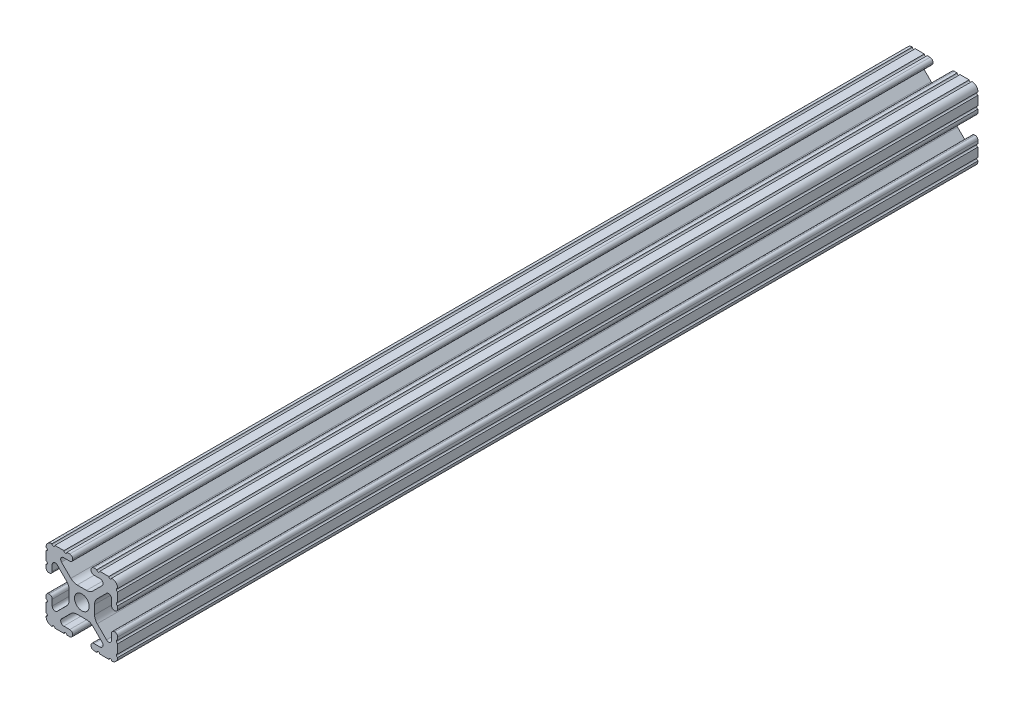
from build123d import *

# Parameters (mm, degrees)
SKETCH1_R           = 2.6035
BOSS_EXTRUDE1_DEPTH = 304.8
SKETCH2_R           = 27.881464852
CUT_EXTRUDE1_DEPTH  = 304.8


with BuildPart() as part:
    # Sketch1 → Boss-Extrude1 (new, symmetric)
    with BuildSketch(Plane.XY):
        with BuildLine():
            Line((-7.179650497, -8.645192506), (-3.952270251, -5.423690499))
            ThreePointArc((-3.952270251, -5.423690499), (-2.922936451, -4.736929036), (-1.709253557, -4.4958))
            Line((-1.709253557, -4.4958), (1.709253557, -4.4958))
            ThreePointArc((1.709253557, -4.4958), (2.922936451, -4.736929036), (3.952270251, -5.423690499))
            Line((3.952270251, -5.423690499), (7.179650497, -8.645192506))
            ThreePointArc((7.179650497, -8.645192506), (7.41473083, -9.822813117), (6.416408329, -10.4902))
            Line((6.416408329, -10.4902), (4.287512407, -10.4902))
            ThreePointArc((4.287512407, -10.4902), (3.54574862, -10.79744862), (3.2385, -11.539212407))
            Line((3.2385, -11.539212407), (3.2385, -11.650987593))
            ThreePointArc((3.2385, -11.650987593), (3.54574862, -12.39275138), (4.287512407, -12.7))
            Line((4.287512407, -12.7), (5.317126718, -12.7))
            ThreePointArc((5.317126718, -12.7), (5.825126718, -12.192), (6.333126718, -12.7))
            Line((6.333126718, -12.7), (9.550443118, -12.7))
            ThreePointArc((9.550443118, -12.7), (10.058366869, -12.192000006), (10.566443095, -12.699847501))
            ThreePointArc((10.566443095, -12.699847501), (12.082537762, -12.08250727), (12.699846982, -10.566399977))
            ThreePointArc((12.699846982, -10.566399977), (12.192000006, -10.058323491), (12.7, -9.5504))
            Line((12.7, -9.5504), (12.7, -6.3330836))
            ThreePointArc((12.7, -6.3330836), (12.192, -5.8250836), (12.7, -5.3170836))
            Line((12.7, -5.3170836), (12.7, -4.287469289))
            ThreePointArc((12.7, -4.287469289), (12.39275138, -3.545705502), (11.650987593, -3.238456882))
            Line((11.650987593, -3.238456882), (11.539212407, -3.238456882))
            ThreePointArc((11.539212407, -3.238456882), (10.79744862, -3.545705502), (10.4902, -4.287469289))
            Line((10.4902, -4.287469289), (10.4902, -6.402089023))
            ThreePointArc((10.4902, -6.402089023), (9.856505071, -7.351067942), (8.737131347, -7.129408934))
            Line((8.737131347, -7.129408934), (5.441005833, -3.840816462))
            ThreePointArc((5.441005833, -3.840816462), (4.750877967, -2.809883091), (4.5085, -1.593185507))
            Line((4.5085, -1.593185507), (4.5085, 1.593185507))
            ThreePointArc((4.5085, 1.593185507), (4.750877967, 2.809883091), (5.441005833, 3.840816462))
            Line((5.441005833, 3.840816462), (8.737131347, 7.129408934))
            ThreePointArc((8.737131347, 7.129408934), (9.856505071, 7.351067942), (10.4902, 6.402089023))
            Line((10.4902, 6.402089023), (10.4902, 4.287469289))
            ThreePointArc((10.4902, 4.287469289), (10.79744862, 3.545705502), (11.539212407, 3.238456882))
            Line((11.539212407, 3.238456882), (11.650987593, 3.238456882))
            ThreePointArc((11.650987593, 3.238456882), (12.39275138, 3.545705502), (12.7, 4.287469289))
            Line((12.7, 4.287469289), (12.7, 5.3170836))
            ThreePointArc((12.7, 5.3170836), (12.192, 5.8250836), (12.7, 6.3330836))
            Line((12.7, 6.3330836), (12.7, 9.5504))
            ThreePointArc((12.7, 9.5504), (12.192000006, 10.058323491), (12.699846982, 10.566399977))
            ThreePointArc((12.699846982, 10.566399977), (12.082537762, 12.08250727), (10.566443095, 12.699847501))
            ThreePointArc((10.566443095, 12.699847501), (10.058366869, 12.192000006), (9.550443118, 12.7))
            Line((9.550443118, 12.7), (6.333126718, 12.7))
            ThreePointArc((6.333126718, 12.7), (5.825126718, 12.192), (5.317126718, 12.7))
            Line((5.317126718, 12.7), (4.287512407, 12.7))
            ThreePointArc((4.287512407, 12.7), (3.54574862, 12.39275138), (3.2385, 11.650987593))
            Line((3.2385, 11.650987593), (3.2385, 11.539212407))
            ThreePointArc((3.2385, 11.539212407), (3.54574862, 10.79744862), (4.287512407, 10.4902))
            Line((4.287512407, 10.4902), (6.476788598, 10.4902))
            ThreePointArc((6.476788598, 10.4902), (7.432222385, 9.85140422), (7.207036008, 8.724370562))
            Line((7.207036008, 8.724370562), (3.898272566, 5.423169045))
            ThreePointArc((3.898272566, 5.423169045), (2.869120213, 4.736787962), (1.655778399, 4.4958))
            Line((1.655778399, 4.4958), (-1.655778399, 4.4958))
            ThreePointArc((-1.655778399, 4.4958), (-2.869120213, 4.736787962), (-3.898272566, 5.423169045))
            Line((-3.898272566, 5.423169045), (-7.207036008, 8.724370562))
            ThreePointArc((-7.207036008, 8.724370562), (-7.432222385, 9.85140422), (-6.476788598, 10.4902))
            Line((-6.476788598, 10.4902), (-4.287512407, 10.4902))
            ThreePointArc((-4.287512407, 10.4902), (-3.54574862, 10.79744862), (-3.2385, 11.539212407))
            Line((-3.2385, 11.539212407), (-3.2385, 11.650987593))
            ThreePointArc((-3.2385, 11.650987593), (-3.54574862, 12.39275138), (-4.287512407, 12.7))
            Line((-4.287512407, 12.7), (-5.317126718, 12.7))
            ThreePointArc((-5.317126718, 12.7), (-5.825126718, 12.192), (-6.333126718, 12.7))
            Line((-6.333126718, 12.7), (-9.550443118, 12.7))
            ThreePointArc((-9.550443118, 12.7), (-10.058366869, 12.192000006), (-10.566443095, 12.699847501))
            ThreePointArc((-10.566443095, 12.699847501), (-12.082537762, 12.08250727), (-12.699846982, 10.566399977))
            ThreePointArc((-12.699846982, 10.566399977), (-12.192000006, 10.058323491), (-12.7, 9.5504))
            Line((-12.7, 9.5504), (-12.7, 6.3330836))
            ThreePointArc((-12.7, 6.3330836), (-12.192, 5.8250836), (-12.7, 5.3170836))
            Line((-12.7, 5.3170836), (-12.7, 4.287469289))
            ThreePointArc((-12.7, 4.287469289), (-12.39275138, 3.545705502), (-11.650987593, 3.238456882))
            Line((-11.650987593, 3.238456882), (-11.539212407, 3.238456882))
            ThreePointArc((-11.539212407, 3.238456882), (-10.79744862, 3.545705502), (-10.4902, 4.287469289))
            Line((-10.4902, 4.287469289), (-10.4902, 6.402089023))
            ThreePointArc((-10.4902, 6.402089023), (-9.856505071, 7.351067942), (-8.737131347, 7.129408934))
            Line((-8.737131347, 7.129408934), (-5.441005833, 3.840816462))
            ThreePointArc((-5.441005833, 3.840816462), (-4.750877967, 2.809883091), (-4.5085, 1.593185507))
            Line((-4.5085, 1.593185507), (-4.5085, -1.593185507))
            ThreePointArc((-4.5085, -1.593185507), (-4.750877967, -2.809883091), (-5.441005833, -3.840816462))
            Line((-5.441005833, -3.840816462), (-8.737131347, -7.129408934))
            ThreePointArc((-8.737131347, -7.129408934), (-9.856505071, -7.351067942), (-10.4902, -6.402089023))
            Line((-10.4902, -6.402089023), (-10.4902, -4.287469289))
            ThreePointArc((-10.4902, -4.287469289), (-10.79744862, -3.545705502), (-11.539212407, -3.238456882))
            Line((-11.539212407, -3.238456882), (-11.650987593, -3.238456882))
            ThreePointArc((-11.650987593, -3.238456882), (-12.39275138, -3.545705502), (-12.7, -4.287469289))
            Line((-12.7, -4.287469289), (-12.7, -5.3170836))
            ThreePointArc((-12.7, -5.3170836), (-12.192, -5.8250836), (-12.7, -6.3330836))
            Line((-12.7, -6.3330836), (-12.7, -9.5504))
            ThreePointArc((-12.7, -9.5504), (-12.192000006, -10.058323491), (-12.699846982, -10.566399977))
            ThreePointArc((-12.699846982, -10.566399977), (-12.082537762, -12.08250727), (-10.566443095, -12.699847501))
            ThreePointArc((-10.566443095, -12.699847501), (-10.058366869, -12.192000006), (-9.550443118, -12.7))
            Line((-9.550443118, -12.7), (-6.333126718, -12.7))
            ThreePointArc((-6.333126718, -12.7), (-5.825126718, -12.192), (-5.317126718, -12.7))
            Line((-5.317126718, -12.7), (-4.287512407, -12.7))
            ThreePointArc((-4.287512407, -12.7), (-3.54574862, -12.39275138), (-3.2385, -11.650987593))
            Line((-3.2385, -11.650987593), (-3.2385, -11.539212407))
            ThreePointArc((-3.2385, -11.539212407), (-3.54574862, -10.79744862), (-4.287512407, -10.4902))
            Line((-4.287512407, -10.4902), (-6.416408329, -10.4902))
            ThreePointArc((-6.416408329, -10.4902), (-7.41473083, -9.822813117), (-7.179650497, -8.645192506))
        make_face()
        Circle(SKETCH1_R, mode=Mode.SUBTRACT)
    extrude(amount=BOSS_EXTRUDE1_DEPTH, both=True)

    # Sketch2 → Cut-Extrude1 (cut)
    with BuildSketch(Plane(origin=(0, 0, -304.8), x_dir=(-1, 0, 0), z_dir=(0, 0, -1))):
        Circle(SKETCH2_R)
    extrude(amount=-CUT_EXTRUDE1_DEPTH, mode=Mode.SUBTRACT)


solid = part.part
